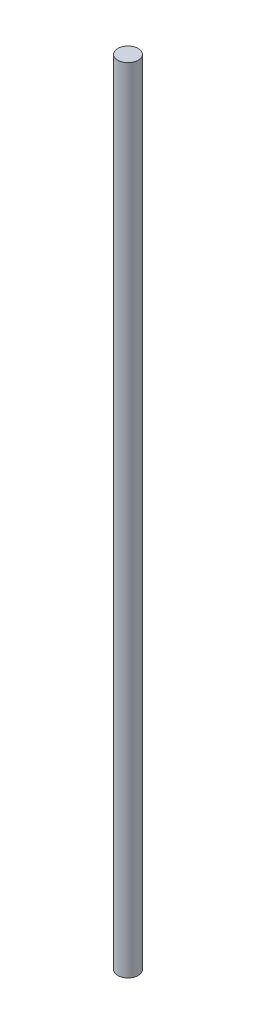
from build123d import *

# Parameters (mm, degrees)
SKETCH1_R           = 4
BOSS_EXTRUDE1_DEPTH = 155


with BuildPart() as part:
    # Sketch1 → Boss-Extrude1 (new, symmetric)
    with BuildSketch(Plane(origin=(0, 0, 0), x_dir=(1, 0, 0), z_dir=(0, 1, 0))):
        Circle(SKETCH1_R)
    extrude(amount=BOSS_EXTRUDE1_DEPTH, both=True)


solid = part.part
